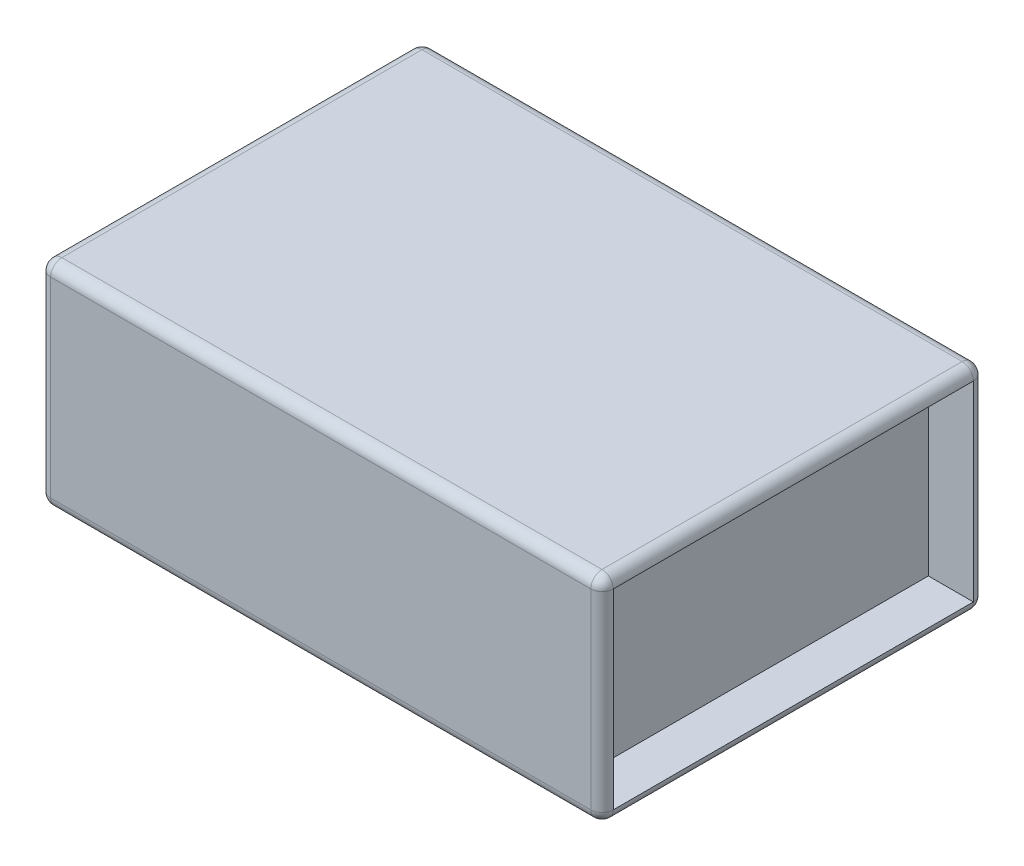
from build123d import *

# Parameters (mm, degrees)
SKETCH1_W           = 50
SKETCH1_H           = 34
BOSS_EXTRUDE1_DEPTH = 19
SKETCH2_W           = 32
SKETCH2_H           = 17
CUT_EXTRUDE1_DEPTH  = 4
FILLET1_R           = 1
FILLET2_R           = 1


# Some blends are built 0.0001 mm under size
with BuildPart() as part:
    # Sketch1 → Boss-Extrude1 (new body)
    with BuildSketch(Plane(origin=(0, 0, 0), x_dir=(1, 0, 0), z_dir=(0, 1, 0))):
        Rectangle(SKETCH1_W, SKETCH1_H)
    extrude(amount=BOSS_EXTRUDE1_DEPTH)

    # Sketch2 → Cut-Extrude1 (cut)
    with BuildSketch(Plane(origin=(25, 0, 0), x_dir=(0, 0, -1), z_dir=(1, 0, 0))):
        with Locations((0, 9.5)):
            Rectangle(SKETCH2_W, SKETCH2_H)
    extrude(amount=-CUT_EXTRUDE1_DEPTH, mode=Mode.SUBTRACT)

    # Fillet1
    fillet1_edges = [part.edges().sort_by_distance(p)[0] for p in [
        (-25, 19, 0),
        (0, 19, 17),
        (25, 19, 0),
        (0, 0, 17),
        (-25, 0, 0),
        (0, 0, -17),
        (25, 0, 0),
        (0, 19, -17),
        (25, 9.5, 17),
        (25, 9.5, -17),
    ]]
    fillet(fillet1_edges, radius=FILLET1_R - 0.0001)  # a hair under: the kernel refuses the full size

    # Fillet2
    # the kernel refuses this fillet: 1 mm, written as the material it takes off along each edge
    with BuildSketch(Plane(origin=(-24, 19, -16), x_dir=(0, 0, -1), z_dir=(1, 0, 0))) as fillet2_piece_1:
        with BuildLine():
            CenterArc((0.0001, -0.9999), 0.9999, 0, 90)
            Line((1, -0.9999), (1, 0))
            Line((1, 0), (0.0001, 0))
        make_face()
    revolve(axis=Axis((-24, 19, -16), (0, 1, 0)), revolution_arc=90, mode=Mode.SUBTRACT)
    with BuildSketch(Plane(origin=(-24, 19, 16), x_dir=(-1, 0, 0), z_dir=(0, 0, -1))) as fillet2_piece_2:
        with BuildLine():
            CenterArc((0.0001, -0.9999), 0.9999, 0, 90)
            Line((1, -0.9999), (1, 0))
            Line((1, 0), (0.0001, 0))
        make_face()
    revolve(axis=Axis((-24, 19, 16), (0, 1, 0)), revolution_arc=90, mode=Mode.SUBTRACT)
    with BuildSketch(Plane(origin=(-24, 0, -16), x_dir=(-1, 0, 0), z_dir=(0, 0, 1))) as fillet2_piece_3:
        with BuildLine():
            CenterArc((0.0001, -0.9999), 0.9999, 0, 90)
            Line((1, -0.9999), (1, 0))
            Line((1, 0), (0.0001, 0))
        make_face()
    revolve(axis=Axis((-24, 0, -16), (0, -1, 0)), revolution_arc=90, mode=Mode.SUBTRACT)
    with BuildSketch(Plane(origin=(-24, 0, 16), x_dir=(0, 0, 1), z_dir=(1, 0, 0))) as fillet2_piece_4:
        with BuildLine():
            CenterArc((0.0001, -0.9999), 0.9999, 0, 90)
            Line((1, -0.9999), (1, 0))
            Line((1, 0), (0.0001, 0))
        make_face()
    revolve(axis=Axis((-24, 0, 16), (0, -1, 0)), revolution_arc=90, mode=Mode.SUBTRACT)
    with BuildSketch(Plane(origin=(-25, 0, 17), x_dir=(0, 0, -1), z_dir=(0, 1, 0)), Plane(origin=(-25, 0, -17), x_dir=(1, 0, 0), z_dir=(0, 1, 0))) as fillet2_piece_5:
        with BuildLine():
            CenterArc((FILLET2_R, -FILLET2_R), FILLET2_R, 90, 90)
            Line((0, -FILLET2_R), (0, 0))
            Line((0, 0), (FILLET2_R, 0))
        make_face()
    extrude(amount=19, mode=Mode.SUBTRACT)


solid = part.part
